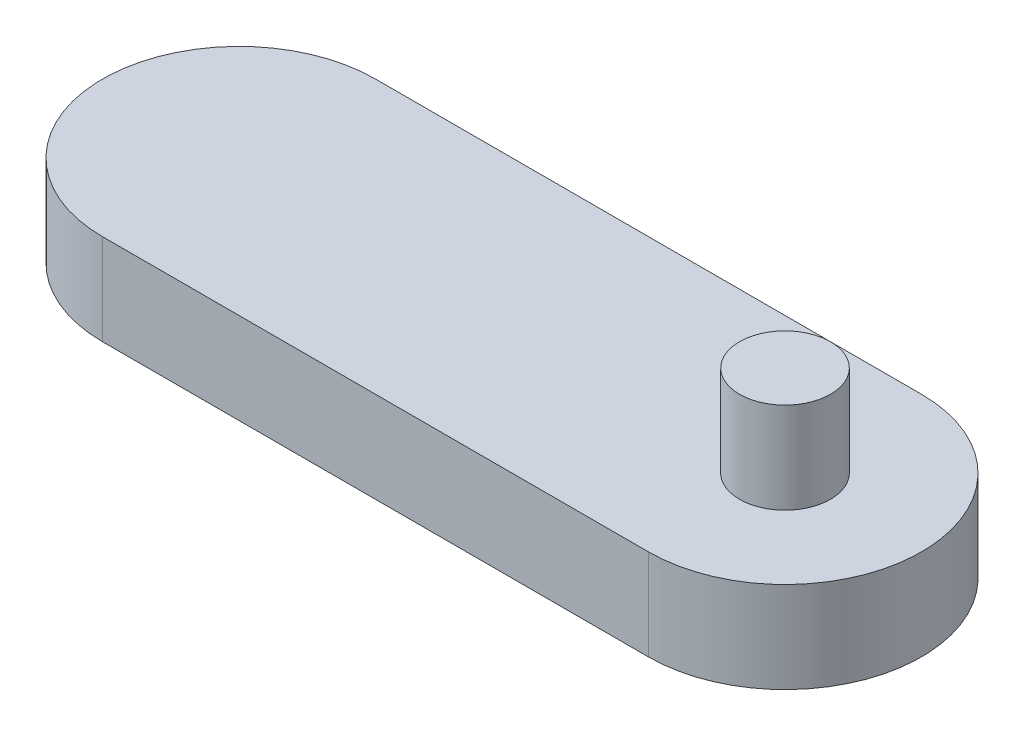
from build123d import *

# Parameters (mm, degrees)
LINK1_DEPTH         = 50.8
SKETCH2_R           = 50.8
BOTTOMCUT_DEPTH     = 25.4
SKETCH3_R           = 25.4
BOSS_EXTRUDE1_DEPTH = 50.8


with BuildPart() as part:
    # Sketch1 → link1 (new body)
    with BuildSketch(Plane(origin=(0, 0, 0), x_dir=(1, 0, 0), z_dir=(0, 1, 0))):
        with BuildLine():
            Line((-152.4, 76.2), (152.4, 76.2))
            ThreePointArc((152.4, 76.2), (228.6, 0), (152.4, -76.2))
            Line((152.4, -76.2), (-152.4, -76.2))
            ThreePointArc((-152.4, -76.2), (-228.6, 0), (-152.4, 76.2))
        make_face()
    extrude(amount=LINK1_DEPTH)

    # Sketch2 → bottomcut (cut)
    with BuildSketch(Plane.XZ):
        with Locations((-152.4, 0)):
            Circle(SKETCH2_R)
    extrude(amount=-BOTTOMCUT_DEPTH, mode=Mode.SUBTRACT)

    # Sketch3 → Boss-Extrude1 (add)
    with BuildSketch(Plane(origin=(0, 50.8, 0), x_dir=(1, 0, 0), z_dir=(0, 1, 0))):
        with Locations((152.4, 0)):
            Circle(SKETCH3_R)
    extrude(amount=BOSS_EXTRUDE1_DEPTH)


solid = part.part
